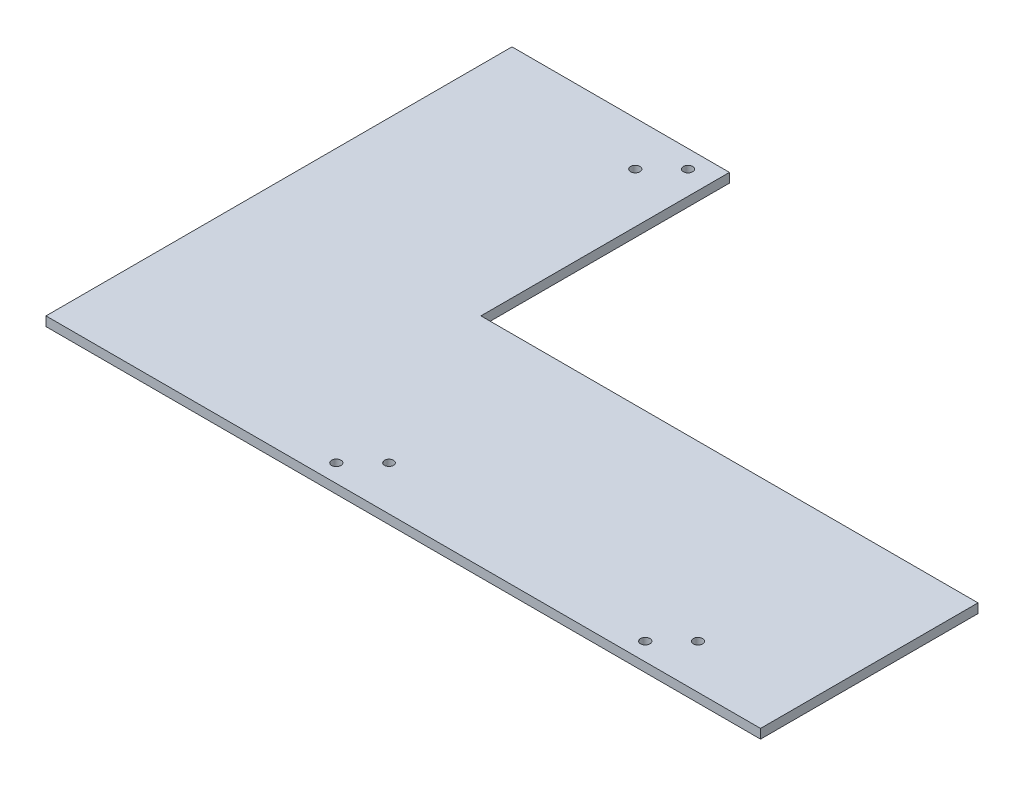
from build123d import *

# Parameters (mm, degrees)
SKETCH1_R           = 1.5
SKETCH1_R_2         = 1.44463942
BOSS_EXTRUDE1_DEPTH = 3


with BuildPart() as part:
    # Sketch1 → Boss-Extrude1 (new body)
    with BuildSketch(Plane(origin=(0, 0, 0), x_dir=(1, 0, 0), z_dir=(0, 1, 0))):
        Polygon((-115, -35), (115, -35), (115, 35), (-45, 35), (-45, 115), (-115, 115), (-115, 35), align=None)
        with Locations((-27.316492004, -29.242640687)):
            Circle(SKETCH1_R, mode=Mode.SUBTRACT)
        with Locations((-18.83121063, -20.757359313)):
            Circle(SKETCH1_R_2, mode=Mode.SUBTRACT)
        with Locations((72.131683696, -29.242640687)):
            Circle(SKETCH1_R, mode=Mode.SUBTRACT)
        with Locations((80.61696507, -20.757359313)):
            Circle(SKETCH1_R, mode=Mode.SUBTRACT)
        with Locations((-61.073682656, 100.757359313)):
            Circle(SKETCH1_R, mode=Mode.SUBTRACT)
        with Locations((-52.588401282, 109.242640687)):
            Circle(SKETCH1_R, mode=Mode.SUBTRACT)
    extrude(amount=BOSS_EXTRUDE1_DEPTH)


solid = part.part
